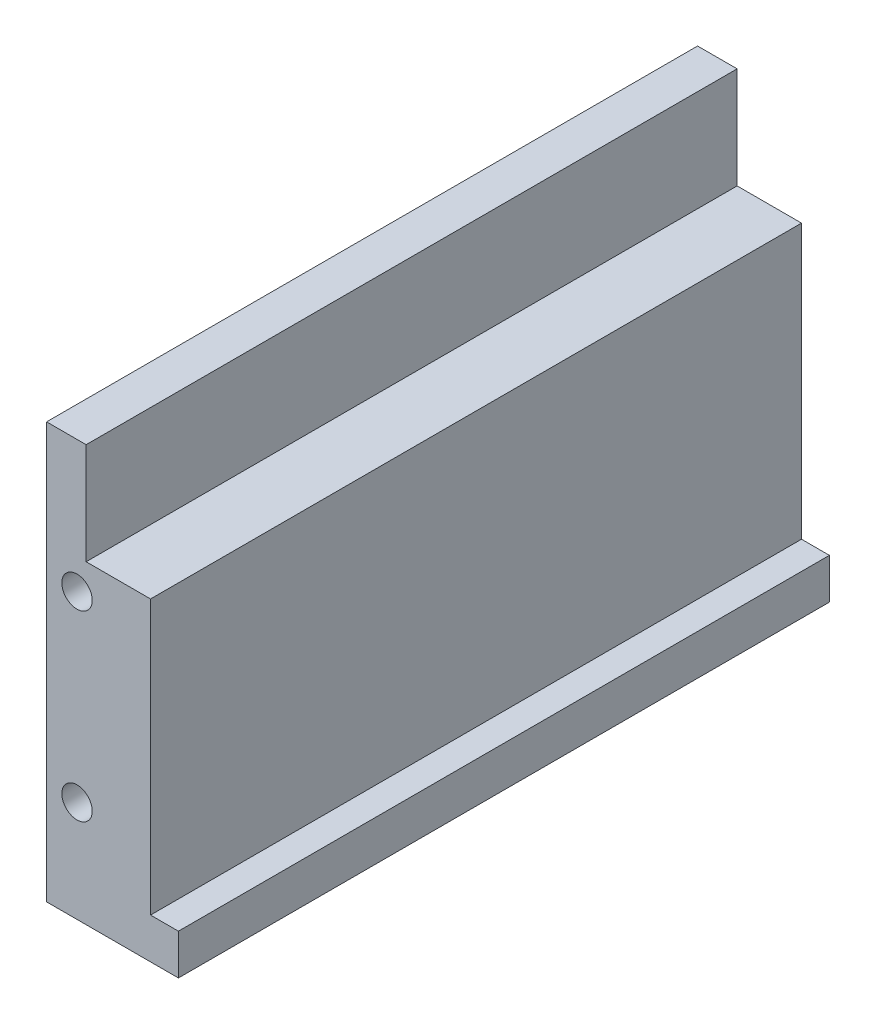
from build123d import *

# Parameters (mm, degrees)
BOSS_EXTRUDE1_DEPTH = 64.2
SKETCH2_R           = 1.5
CUT_EXTRUDE1_DEPTH  = 5


with BuildPart() as part:
    # Sketch1 → Boss-Extrude1 (new body)
    with BuildSketch(Plane.XY):
        Polygon((0, 0), (0, 41), (3.9, 41), (3.9, 31), (10.25, 31), (10.25, 4), (13, 4), (13, 0), align=None)
    extrude(amount=BOSS_EXTRUDE1_DEPTH)

    # Sketch2 → Cut-Extrude1 (cut)
    with BuildSketch(Plane.XY.offset(64.2)):
        with Locations((3, 28)):
            Circle(SKETCH2_R)
        with Locations((3, 10)):
            Circle(SKETCH2_R)
    cut_extrude1 = extrude(amount=-CUT_EXTRUDE1_DEPTH, mode=Mode.SUBTRACT)

    # Mirror1: Cut-Extrude1 across plane
    add(cut_extrude1.mirror(Plane.XY.offset(32.1)), mode=Mode.SUBTRACT)


solid = part.part
